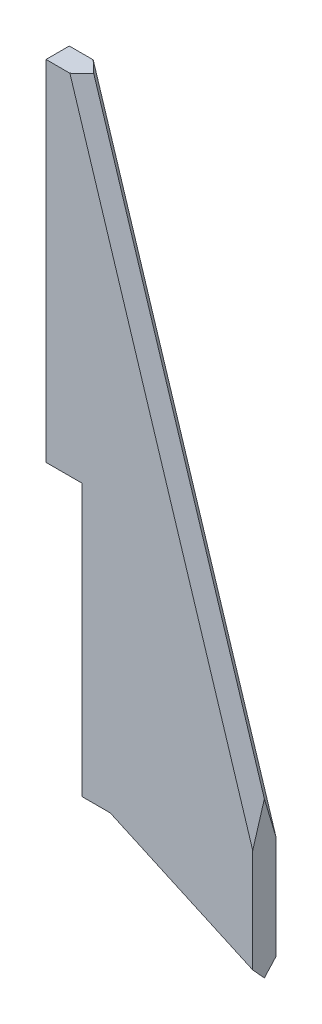
from build123d import *

# Parameters (mm, degrees)
BOSS_EXTRUDE1_DEPTH     = 1.5
SKETCH7_W               = 3
SKETCH7_H               = 80
BOSS_EXTRUDE2_DEPTH     = 4.655
CHAMFER1_SIZE           = 1.5
CUT_EXTRUDE1_DEPTH      = 83.983432081
CUT_EXTRUDE1_DEPTH_BACK = 83.983432081
SKETCH8_W               = 4.655
SKETCH8_H               = 35


with BuildPart() as part:
    # Sketch1 → Boss-Extrude1 (new, symmetric)
    with BuildSketch(Plane.XY):
        Polygon((0, 0), (0, 80), (22, 10), (22, -10), align=None)
    extrude(amount=BOSS_EXTRUDE1_DEPTH, both=True)

    # Sketch7 → Boss-Extrude2 (add)
    with BuildSketch(Plane.ZY):
        with Locations((0, 40)):
            Rectangle(SKETCH7_W, SKETCH7_H)
    extrude(amount=BOSS_EXTRUDE2_DEPTH)

    # Chamfer1
    chamfer1_edges = [part.edges().sort_by_distance(p)[0] for p in [
        (11, -5, 1.5),
        (11, -5, -1.5),
        (11, 45, -1.5),
        (11, 45, 1.5),
    ]]
    chamfer(chamfer1_edges, length=CHAMFER1_SIZE - 0.0001)  # a hair under: the kernel refuses the full size

    # Sketch8 → Cut-Extrude1 (cut, two sides: drawn at the far end of the back side and taken through both)
    with BuildSketch(Plane.XY.offset(-CUT_EXTRUDE1_DEPTH_BACK)):
        with Locations((-2.3275, 17.5)):
            Rectangle(SKETCH8_W, SKETCH8_H)
    extrude(amount=CUT_EXTRUDE1_DEPTH + CUT_EXTRUDE1_DEPTH_BACK, mode=Mode.SUBTRACT)


solid = part.part
